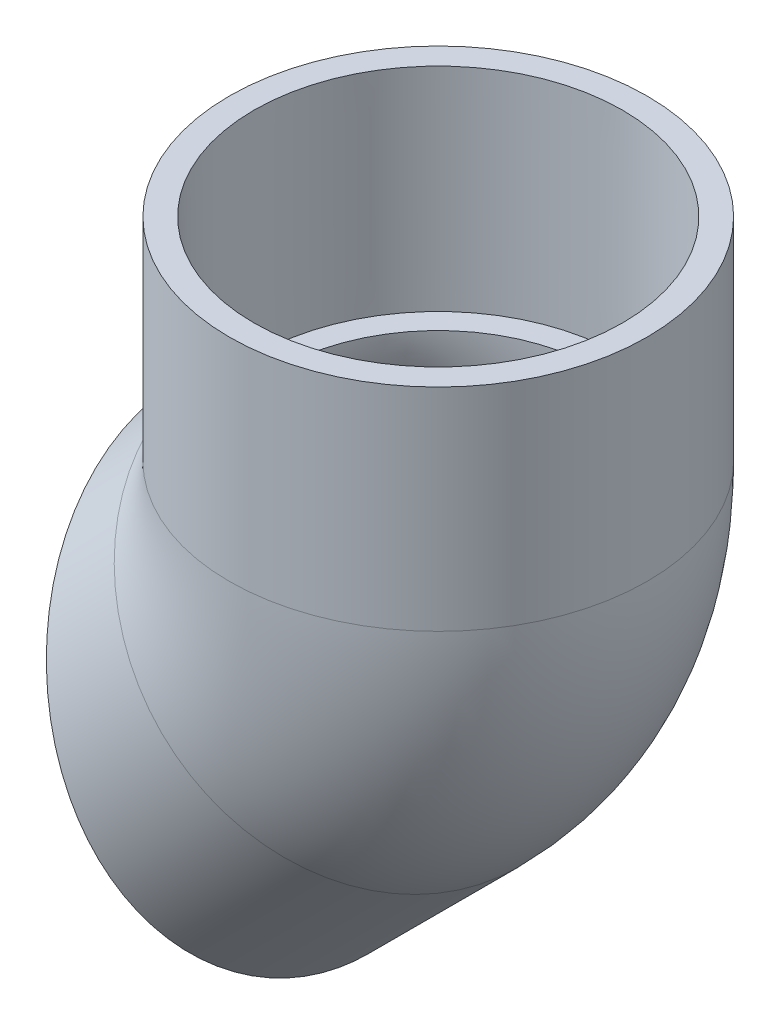
from build123d import *

# Parameters (mm, degrees)
SKETCH3_R               = 34.3535
SKETCH3_R_2             = 26.2509
CUT_EXTRUDE1_DEPTH      = 92.704245656
CUT_EXTRUDE1_DEPTH_BACK = 92.704245656


with BuildPart() as part:
    # Sketch1 → Revolve1 (revolve)
    with BuildSketch(Plane.XY):
        Polygon((-11.539629116, -60.122814731), (13.066272656, -35.516912959), (10.048906599, -32.499546902), (-14.395350562, -57.267093284), align=None)
    revolve(axis=Axis((-35.831221923, -35.831221923, 0), (0.7071067811865488, 0.7071067811865464, 0)))



with BuildPart() as body_2:
    # Sketch2 → Revolve2 (revolve)
    with BuildSketch(Plane.XY):
        Polygon((30.3149, 50.673), (30.0863, 15.875), (34.3535, 15.875), (34.3535, 50.673), align=None)
    revolve(axis=Axis((0, 0, 0), (0, 1, 0)))


with BuildPart() as part_1:
    add(part.part)

    add(body_2.part)  # Sweep1 merges body 2
    # Sweep1: sweep along a path in Sketch4
    with BuildLine(Plane.XY) as sweep1_path:
        ThreePointArc((-11.225320151, -11.225320151), (-2.917365657, 1.208412421), (0, 15.875))
    # Sketch3 → Sweep1 (sweep)
    with BuildSketch(Plane(origin=(-11.225320151, -11.225320151, 0), x_dir=(0, 0, -1), z_dir=(0.7071067811865486, 0.7071067811865465, 0))):
        Circle(SKETCH3_R)
        Circle(SKETCH3_R_2, mode=Mode.SUBTRACT)
    sweep(path=sweep1_path.line)

    # Sketch5 → Cut-Extrude1 (cut, two sides: drawn at the far end of the back side and taken through both)
    with BuildSketch(Plane.XY.offset(-CUT_EXTRUDE1_DEPTH_BACK)):
        Polygon((-42.162302488, 6.420883127), (-60.122814731, -11.539629116), (-11.539629116, -60.122814731), align=None)
    extrude(amount=CUT_EXTRUDE1_DEPTH + CUT_EXTRUDE1_DEPTH_BACK, mode=Mode.SUBTRACT)


solid = part_1.part
